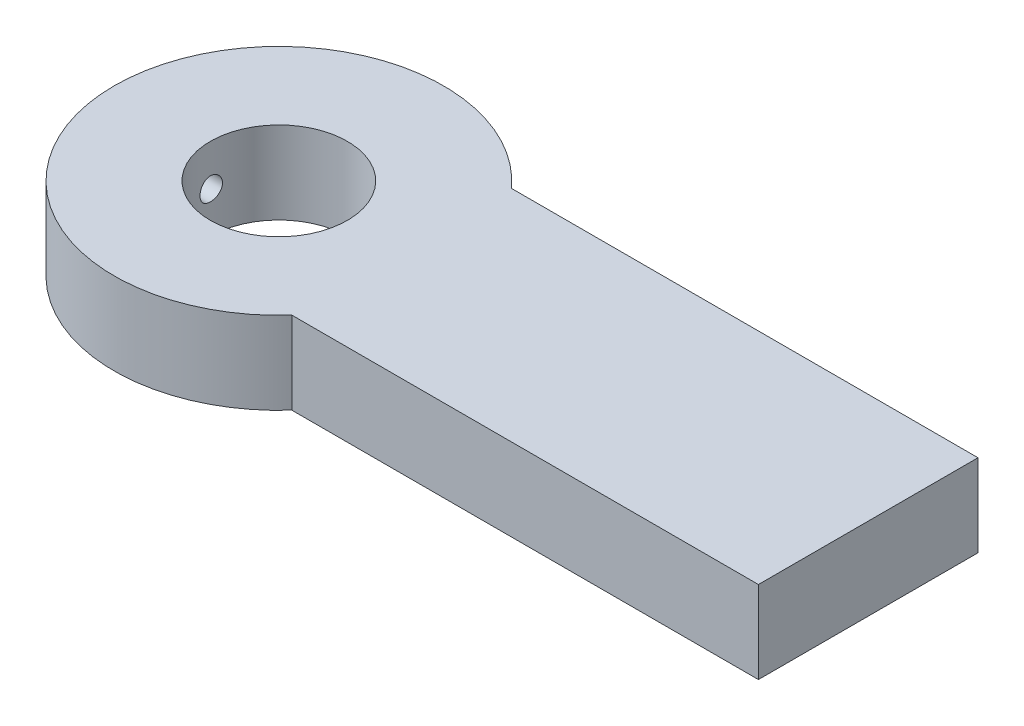
from build123d import *

# Parameters (mm, degrees)
SKETCH1_R           = 12.48
BOSS_EXTRUDE1_DEPTH = 15
SKETCH2_R           = 2.05
CUT_EXTRUDE1_DEPTH  = 113.478067025


with BuildPart() as part:
    # Sketch1 → Boss-Extrude1 (new body)
    with BuildSketch(Plane(origin=(0, 0, 0), x_dir=(1, 0, 0), z_dir=(0, 1, 0))):
        with BuildLine():
            Line((22.360679775, 20), (107.360679775, 20))
            Line((107.360679775, 20), (107.360679775, -20))
            Line((107.360679775, -20), (22.360679775, -20))
            ThreePointArc((22.360679775, -20), (-30, 0), (22.360679775, 20))
        make_face()
        Circle(SKETCH1_R, mode=Mode.SUBTRACT)
    extrude(amount=BOSS_EXTRUDE1_DEPTH)

    # Sketch2 → Cut-Extrude1 (cut, through all)
    with BuildSketch(Plane(origin=(0, 0, 0), x_dir=(0, 0, -1), z_dir=(1, 0, 0))):
        with Locations((0, 7.5)):
            Circle(SKETCH2_R)
    extrude(amount=-CUT_EXTRUDE1_DEPTH, mode=Mode.SUBTRACT)


solid = part.part
